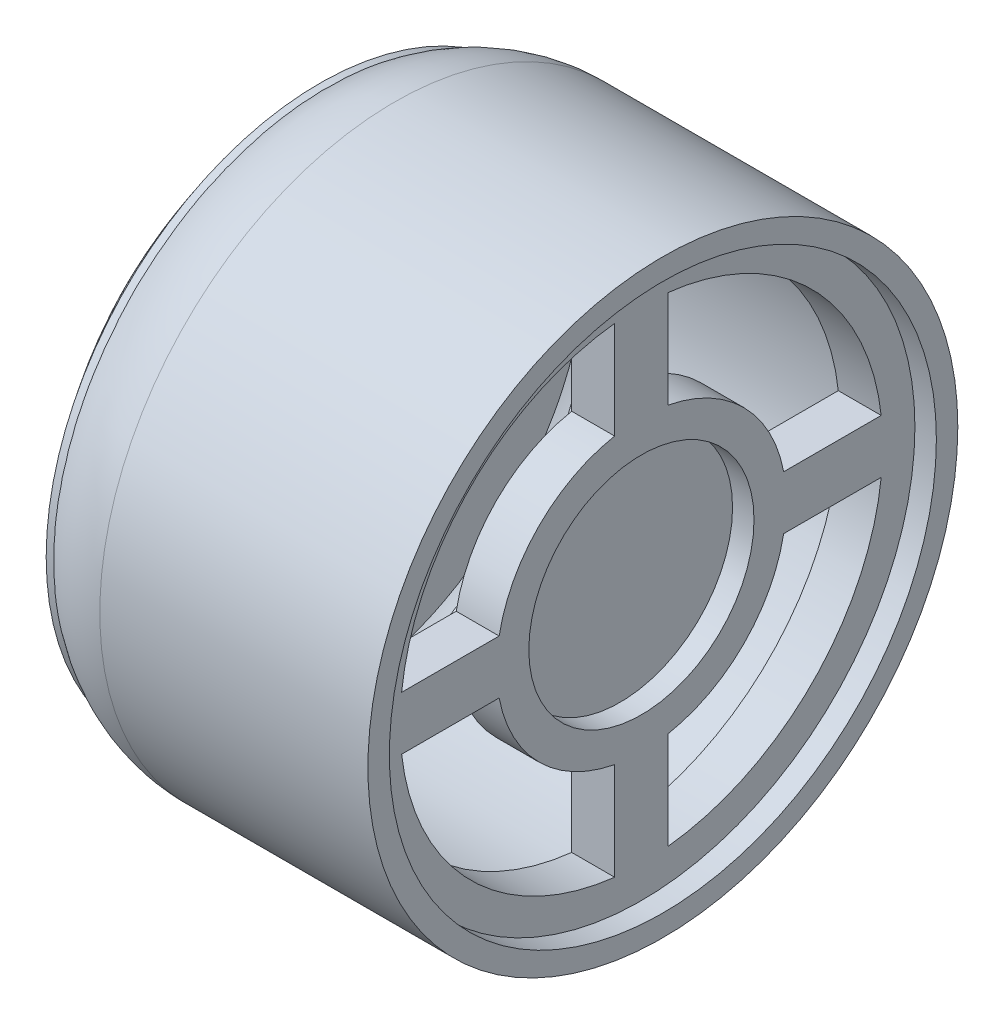
from build123d import *

# Parameters (mm, degrees)
SKETCH1_R           = 27.505813168
SKETCH1_R_2         = 25.505813168
BOSS_EXTRUDE1_DEPTH = 30
SKETCH2_R           = 27.505813168
SKETCH2_R_2         = 25.505813168
BOSS_EXTRUDE4_DEPTH = 6
SKETCH2_4_R         = 25.505813168
SKETCH2_4_R_2       = 10.5
BOSS_EXTRUDE5_DEPTH = 4
SKETCH2_5_R         = 10.5
BOSS_EXTRUDE6_DEPTH = 2
SKETCH3_R           = 25.505813168
SKETCH3_R_2         = 10.25
BOSS_EXTRUDE8_DEPTH = 4
FILLET6_R           = 11
CUT_EXTRUDE3_REACH  = 53.664


with BuildPart() as part:
    # Sketch1 → Boss-Extrude1 (new body)
    with BuildSketch(Plane.YZ):
        Circle(SKETCH1_R)
        Circle(SKETCH1_R_2, mode=Mode.SUBTRACT)
    extrude(amount=BOSS_EXTRUDE1_DEPTH)

    # Sketch2 → Boss-Extrude4 (add)
    with BuildSketch(Plane.YZ.offset(30)):
        Circle(SKETCH2_R)
        Circle(SKETCH2_R_2, mode=Mode.SUBTRACT)
    extrude(amount=BOSS_EXTRUDE4_DEPTH)

    # Sketch2<4> → Boss-Extrude5 (add)
    with BuildSketch(Plane.YZ.offset(30)):
        Circle(SKETCH2_4_R)
        Circle(SKETCH2_4_R_2, mode=Mode.SUBTRACT)
    extrude(amount=BOSS_EXTRUDE5_DEPTH)

    # Sketch2<5> → Boss-Extrude6 (add)
    with BuildSketch(Plane.YZ.offset(30)):
        Circle(SKETCH2_5_R)
    extrude(amount=BOSS_EXTRUDE6_DEPTH)

    # Sketch3 → Boss-Extrude8 (add)
    with BuildSketch(Plane(origin=(0, 0, 0), x_dir=(0, -1, 0), z_dir=(-1, 0, 0))):
        Circle(SKETCH3_R)
        Circle(SKETCH3_R_2, mode=Mode.SUBTRACT)
    extrude(amount=-BOSS_EXTRUDE8_DEPTH)

    # Fillet6
    fillet6_edges = [part.edges().sort_by_distance(p)[0] for p in [
        (0, -27.505813168, 0),
    ]]
    fillet(fillet6_edges, radius=FILLET6_R)

    # Sketch8 → Cut-Extrude3 (cut, up to next)
    with BuildSketch(Plane.YZ.offset(34), mode=Mode.PRIVATE) as cut_extrude3_sk1:
        with BuildLine():
            Line((-2.5, 13.266499161), (-2.5, 22.360679775))
            ThreePointArc((-2.5, 22.360679775), (-15.909902577, 15.909902577), (-22.360679775, 2.5))
            Line((-22.360679775, 2.5), (-13.266499161, 2.5))
            ThreePointArc((-13.266499161, 2.5), (-9.545941546, 9.545941546), (-2.5, 13.266499161))
        make_face()
    cut_extrude3_tool1 = extrude(cut_extrude3_sk1.sketch, amount=-CUT_EXTRUDE3_REACH, mode=Mode.PRIVATE) & part.part
    # Sketch8 → Cut-Extrude3 (cut, up to next)
    with BuildSketch(Plane.YZ.offset(34), mode=Mode.PRIVATE) as cut_extrude3_sk2:
        with BuildLine():
            ThreePointArc((22.360679775, 2.5), (15.909902577, 15.909902577), (2.5, 22.360679775))
            Line((2.5, 22.360679775), (2.5, 13.266499161))
            ThreePointArc((2.5, 13.266499161), (9.545941546, 9.545941546), (13.266499161, 2.5))
            Line((13.266499161, 2.5), (22.360679775, 2.5))
        make_face()
    cut_extrude3_tool2 = extrude(cut_extrude3_sk2.sketch, amount=-CUT_EXTRUDE3_REACH, mode=Mode.PRIVATE) & part.part
    # Sketch8 → Cut-Extrude3 (cut, up to next)
    with BuildSketch(Plane.YZ.offset(34), mode=Mode.PRIVATE) as cut_extrude3_sk3:
        with BuildLine():
            Line((-13.266499161, -2.5), (-22.360679775, -2.5))
            ThreePointArc((-22.360679775, -2.5), (-15.909902577, -15.909902577), (-2.5, -22.360679775))
            Line((-2.5, -22.360679775), (-2.5, -13.266499161))
            ThreePointArc((-2.5, -13.266499161), (-9.545941546, -9.545941546), (-13.266499161, -2.5))
        make_face()
    cut_extrude3_tool3 = extrude(cut_extrude3_sk3.sketch, amount=-CUT_EXTRUDE3_REACH, mode=Mode.PRIVATE) & part.part
    # Sketch8 → Cut-Extrude3 (cut, up to next)
    with BuildSketch(Plane.YZ.offset(34), mode=Mode.PRIVATE) as cut_extrude3_sk4:
        with BuildLine():
            ThreePointArc((2.5, -22.360679775), (15.909902577, -15.909902577), (22.360679775, -2.5))
            Line((22.360679775, -2.5), (13.266499161, -2.5))
            ThreePointArc((13.266499161, -2.5), (9.545941546, -9.545941546), (2.5, -13.266499161))
            Line((2.5, -13.266499161), (2.5, -22.360679775))
        make_face()
    cut_extrude3_tool4 = extrude(cut_extrude3_sk4.sketch, amount=-CUT_EXTRUDE3_REACH, mode=Mode.PRIVATE) & part.part
    add(cut_extrude3_tool1.solids().sort_by_distance((34, -12.15155, 12.15155))[0], mode=Mode.SUBTRACT)
    add(cut_extrude3_tool2.solids().sort_by_distance((34, 12.15155, 12.15155))[0], mode=Mode.SUBTRACT)
    add(cut_extrude3_tool3.solids().sort_by_distance((34, -12.15155, -12.15155))[0], mode=Mode.SUBTRACT)
    add(cut_extrude3_tool4.solids().sort_by_distance((34, 12.15155, -12.15155))[0], mode=Mode.SUBTRACT)


solid = part.part
